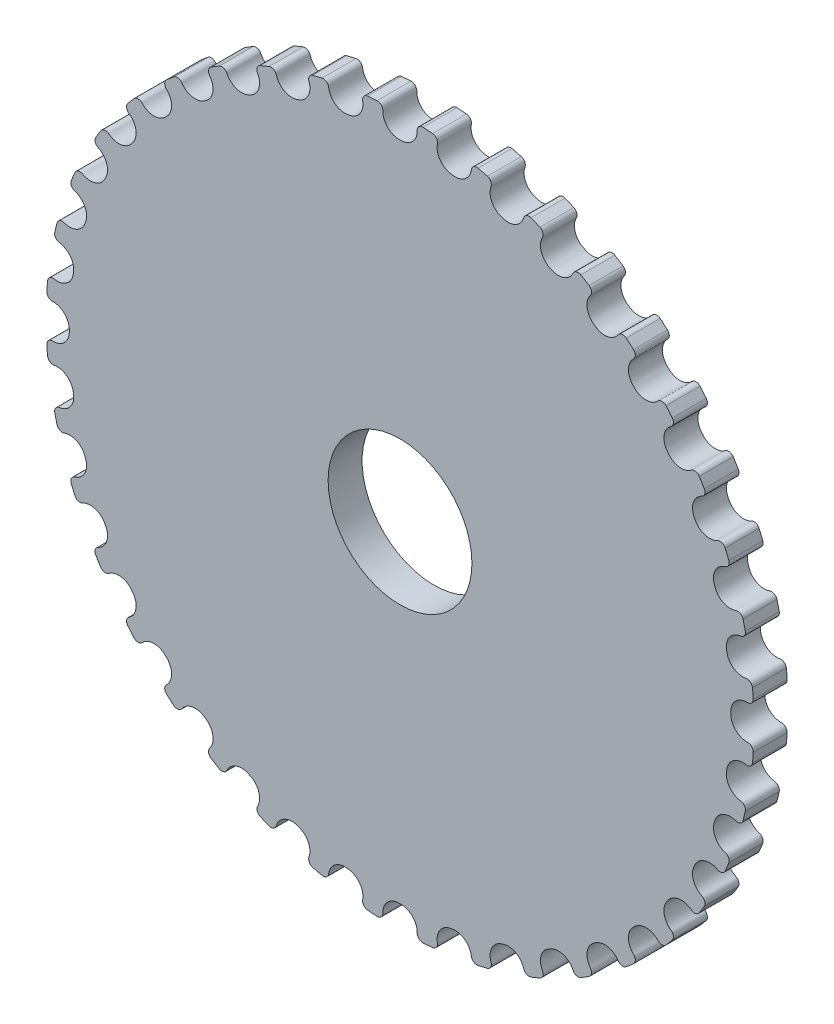
from build123d import *

# Parameters (mm, degrees)
SKETCHREVOLVEGEARBELT01_W       = 3
SKETCHREVOLVEGEARBELT01_H       = 31.259474731
TOOTHEXTRUDECUTGEARBELT01_DEPTH = 7.238999891
PATTERNGEARBELT01_COUNT         = 40
BOREREVOLVESKETCH_W             = 14.477999782
BOREREVOLVESKETCH_H             = 6.349999905


with BuildPart() as part:
    # SketchRevolveGearBelt01 → GearBelt01 (revolve)
    with BuildSketch(Plane(origin=(0, 0, 0), x_dir=(0, 0, -1), z_dir=(1, 0, 0))):
        with Locations((0, 15.629737366)):
            Rectangle(SKETCHREVOLVEGEARBELT01_W, SKETCHREVOLVEGEARBELT01_H)
    revolve(axis=Axis((0, 0, 0), (0, 0, -1)))

    # SketchToothGearBelt01 → ToothExtrudeCutGearBelt01 (cut, symmetric)
    with BuildSketch(Plane.XY):
        with BuildLine():
            ThreePointArc((31.193039128, 2.038865882), (31.259601152, 0), (31.193039128, -2.038865882))
            add(Edge.make_bspline(
                [(31.193039128, -2.038865882), (31.194776913, -2.012319058), (31.194111995, -1.972286092), (31.186725044, -1.91954954), (31.177972892, -1.880581805), (31.166066964, -1.842459179), (31.151086916, -1.805436436), (31.133132836, -1.769761004), (31.11232472, -1.735671302), (31.088801629, -1.703395156), (31.062720769, -1.673148271), (31.03425644, -1.645132783), (31.003598871, -1.619535939), (30.970952951, -1.596528744), (30.936536852, -1.576265181), (30.900580587, -1.558879838), (30.863324423, -1.544492019), (30.825017467, -1.533186249), (30.785915276, -1.525081482), (30.746280852, -1.520069931), (30.699160655, -1.5185581), (30.627744929, -1.519642809), (30.531954075, -1.516025397), (30.419766309, -1.502618406), (30.308964203, -1.4805345), (30.200238466, -1.449806972), (30.094256736, -1.410652655), (29.991672503, -1.363305381), (29.893117585, -1.308058815), (29.799199177, -1.245252775), (29.710495857, -1.175274324), (29.627554091, -1.09855453), (29.55088484, -1.015566038), (29.480960449, -0.926820101), (29.418211615, -0.832863447), (29.363025195, -0.73427489), (29.31574008, -0.631661826), (29.276651638, -0.525656278), (29.245985501, -0.416911781), (29.223987221, -0.306096466), (29.210580967, -0.193899714), (29.207480791, -0.105119728), (29.207768884, -0.040500395), (29.2077087, 0), (29.207768884, 0.040500395), (29.207480791, 0.105119728), (29.210580967, 0.193899714), (29.223987221, 0.306096466), (29.245985501, 0.416911781), (29.276651638, 0.525656278), (29.31574008, 0.631661826), (29.363025195, 0.73427489), (29.418211615, 0.832863447), (29.480960449, 0.926820101), (29.55088484, 1.015566038), (29.627554091, 1.09855453), (29.710495857, 1.175274324), (29.799199177, 1.245252775), (29.893117585, 1.308058815), (29.991672503, 1.363305381), (30.094256736, 1.410652655), (30.200238466, 1.449806972), (30.308964203, 1.4805345), (30.419766309, 1.502618406), (30.531954075, 1.516025397), (30.627744929, 1.519642809), (30.699160655, 1.5185581), (30.746280852, 1.520069931), (30.785915276, 1.525081482), (30.825017467, 1.533186249), (30.863324423, 1.544492019), (30.900580587, 1.558879838), (30.936536852, 1.576265181), (30.970952951, 1.596528744), (31.003598871, 1.619535939), (31.03425644, 1.645132783), (31.062720769, 1.673148271), (31.088801629, 1.703395156), (31.11232472, 1.735671302), (31.133132836, 1.769761004), (31.151086916, 1.805436436), (31.166066964, 1.842459179), (31.177972892, 1.880581805), (31.186725044, 1.91954954), (31.194111995, 1.972286092), (31.194776913, 2.012319058), (31.193039128, 2.038865882)],
                knots=[0, 0, 0, 0, 0.012475647, 0.018713471, 0.024951294, 0.031189118, 0.037426941, 0.043664765, 0.049902589, 0.056140412, 0.062378236, 0.068616059, 0.074853883, 0.081091706, 0.08732953, 0.093567353, 0.099805177, 0.106043001, 0.112280824, 0.118518648, 0.124756471, 0.134376181, 0.152024115, 0.169672048, 0.187319982, 0.204967916, 0.22261585, 0.240263783, 0.257911717, 0.275559651, 0.293207585, 0.310855518, 0.328503452, 0.346151386, 0.36379932, 0.381447253, 0.399095187, 0.416743121, 0.434391055, 0.452038988, 0.469686922, 0.487334856, 0.493667428, 0.5, 0.506332572, 0.512665144, 0.530313078, 0.547961012, 0.565608945, 0.583256879, 0.600904813, 0.618552747, 0.63620068, 0.653848614, 0.671496548, 0.689144482, 0.706792415, 0.724440349, 0.742088283, 0.759736217, 0.77738415, 0.795032084, 0.812680018, 0.830327952, 0.847975885, 0.865623819, 0.875243529, 0.881481352, 0.887719176, 0.893956999, 0.900194823, 0.906432647, 0.91267047, 0.918908294, 0.925146117, 0.931383941, 0.937621764, 0.943859588, 0.950097411, 0.956335235, 0.962573059, 0.968810882, 0.975048706, 0.981286529, 0.987524353, 1, 1, 1, 1], degree=3))
        make_face()
    toothextrudecutgearbelt01 = extrude(amount=TOOTHEXTRUDECUTGEARBELT01_DEPTH, both=True, mode=Mode.SUBTRACT)

    # PatternGearBelt01: ToothExtrudeCutGearBelt01 ×40 about axis
    patterngearbelt01_axis = Axis((0, 0, 55), (0, 0, -1))
    for i in range(1, PATTERNGEARBELT01_COUNT):
        add(toothextrudecutgearbelt01.rotate(patterngearbelt01_axis, i * 360 / PATTERNGEARBELT01_COUNT), mode=Mode.SUBTRACT)

    # BoreRevolveSketch → BoreRevolveCut (revolve, cut)
    with BuildSketch(Plane(origin=(0, 0, 0), x_dir=(0, 0, -1), z_dir=(1, 0, 0))):
        with Locations((0, 3.174999953)):
            Rectangle(BOREREVOLVESKETCH_W, BOREREVOLVESKETCH_H)
    revolve(axis=Axis((0, 0, 0), (0, 0, -1)), mode=Mode.SUBTRACT)


solid = part.part
